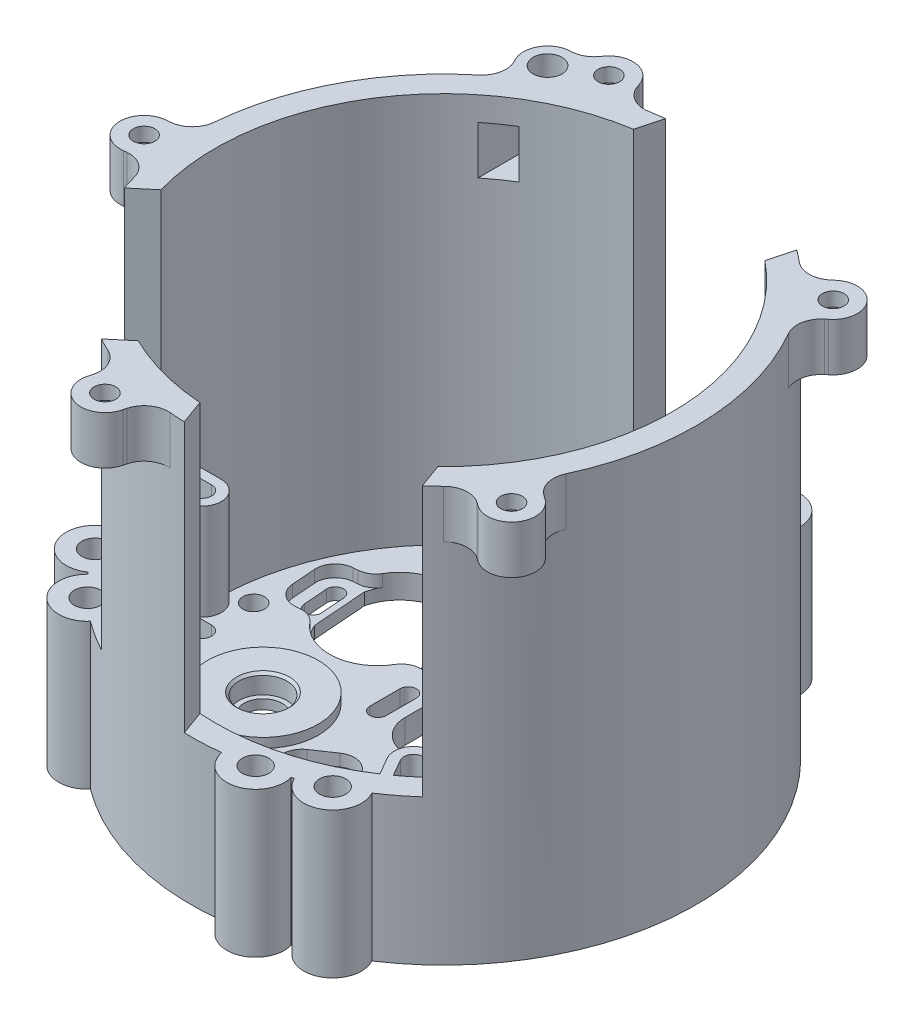
from build123d import *
from build123d.topology import SkipClean

# Parameters (mm, degrees)
CIRPATTERN1_COUNT              = 3
BOSS_EXTRUDE3_START            = -4
SKETCH3_R                      = 47.5
SKETCH3_R_2                    = 11.5
SKETCH3_R_3                    = 10
BOSS_EXTRUDE3_DEPTH            = 5
R_P_TITION_CIRCULAIRE1_COUNT   = 3
ENL_V_MAT_EXTRU_2_DEPTH        = 68.549315319
ENL_V_MAT_EXTRU_2_DEPTH_BACK   = 68.549315319
CHANFREIN1_SIZE                = 0.5
CONG_1_R                       = 1
CHANFREIN3_SIZE                = 1.5
ENL_V_START                    = -2.5
ENL_V_MAT_EXTRU_3_DEPTH        = 2.5
ENL_V_MAT_EXTRU_4_REACH        = 69.361
BOSS_EXTRU_1_START             = -5
BOSS_EXTRU_1_DEPTH             = 2.5
CONG_2_R                       = 4
ESQUISSE9_R                    = 5
ESQUISSE9_R_2                  = 2
BOSS_EXTRU_2_DEPTH             = 4
M2_CLEARANCE_HOLE1_D           = 2.4
M4_CLEARANCE_HOLE1_D           = 4.5
ENL_V_MAT_EXTRU_5_REACH        = 69.361
ESQUISSE18_R                   = 52.5
ESQUISSE18_R_2                 = 47.5
BOSS_EXTRU_3_DEPTH             = 30.25
BOSS_EXTRU_4_DEPTH             = 56
BOSS_EXTRU_5_START             = -30.25
BOSS_EXTRU_5_DEPTH             = 30.25
M5_CLEARANCE_HOLE1_D           = 5.5
F_7_1_7_1_DIAMETER_HOLE1_D     = 7.1
F_7_1_7_1_DIAMETER_HOLE1_DEPTH = 11.1
F_7_1_7_1_DIAMETER_HOLE1_TIP   = 2.133055198
CHANFREIN4_SIZE                = 0.5
BOSS_EXTRU_7_START             = -10
ESQUISSE27_R                   = 2.7
BOSS_EXTRU_7_DEPTH             = 10
BOSS_EXTRU_8_START             = -2.9
ESQUISSE27_2_R                 = 2.7
BOSS_EXTRU_8_DEPTH             = 2.9
M4_CLEARANCE_HOLE2_D           = 4.5
CONG_4_R                       = 5
CHANFREIN5_SIZE                = 0.5
SKETCH4_R                      = 5
SKETCH4_R_2                    = 3
BOSS_EXTRUDE8_DEPTH            = 86.25
FILLET1_R                      = 5
FILLET2_R                      = 5
CUT_EXTRUDE1_REACH             = 121.621
CUT_EXTRUDE1_END_RADIUS        = 3
SKETCH5_W                      = 5
SKETCH5_H                      = 10
CUT_EXTRUDE2_START             = 2.25
CUT_EXTRUDE2_DEPTH             = 10
CUT_EXTRUDE2_START_2           = 22.25
CUT_EXTRUDE2_2_DEPTH           = 10
CUT_EXTRUDE2_START_3           = 42.25
CUT_EXTRUDE2_3_DEPTH           = 10
CUT_EXTRUDE2_START_4           = 62.25
CUT_EXTRUDE2_4_DEPTH           = 10
FILLET3_R                      = 5
BOSS_EXTRUDE9_DEPTH            = 20
CUT_EXTRUDE4_DEPTH             = 104.344704146
CUT_EXTRUDE4_DEPTH_BACK        = 104.344704146


# Read off the part's stored shape, not the designer's step: Cut-Extrude2
with BuildPart() as part:
    # Sketch2 → Revolve1 (revolve)
    with BuildSketch(Plane(origin=(0, 0, 0), x_dir=(0, 0, -1), z_dir=(1, 0, 0))):
        Polygon((21, 0), (21, -3), (23.5, -3), (23.5, -1), (22.5, -1), (22.5, 3), (16, 3), (16, -4), (17.5, -4), (17.5, 0), align=None)
    revolve(axis=Axis((0, 24.43625, -27.5), (0, -1, 0)))


with BuildPart() as cirpattern1_1:
    # CirPattern1: pattern copy
    add(part.part.rotate(Axis((0, 0, 0), (0, 1, 0)), 1 * 360 / CIRPATTERN1_COUNT))


with BuildPart() as cirpattern1_2:
    # CirPattern1: pattern copy
    add(part.part.rotate(Axis((0, 0, 0), (0, 1, 0)), 2 * 360 / CIRPATTERN1_COUNT))


with BuildPart() as part_1:
    add(part.part)

    add(cirpattern1_1.part)  # Boss-Extrude3 merges CirPattern1_1

    add(cirpattern1_2.part)  # Boss-Extrude3 merges CirPattern1_2
    # Sketch3 → Boss-Extrude3 (add)
    with BuildSketch(Plane(origin=(0, 0, 0), x_dir=(1, 0, 0), z_dir=(0, 1, 0)).offset(BOSS_EXTRUDE3_START)):
        Circle(SKETCH3_R)
        with Locations(Location((-23.815698604, -13.75, 0), (0, 0, 30))):
            Circle(SKETCH3_R_2, mode=Mode.SUBTRACT)
        with Locations((0, -30)):
            Circle(SKETCH3_R_3, mode=Mode.SUBTRACT)
        with Locations(Location((23.815698604, -13.75, 0), (0, 0, 150))):
            Circle(SKETCH3_R_2, mode=Mode.SUBTRACT)
        with Locations((-25.980762114, 15)):
            Circle(SKETCH3_R_3, mode=Mode.SUBTRACT)
        with BuildLine():
            ThreePointArc((6.5, -1.5), (0, -8), (-6.5, -1.5))
            Line((-6.5, -1.5), (-6.5, 5.5))
            ThreePointArc((-6.5, 5.5), (0, 12), (6.5, 5.5))
            Line((6.5, 5.5), (6.5, -1.5))
        make_face(mode=Mode.SUBTRACT)
        with Locations((25.980762114, 15)):
            Circle(SKETCH3_R_3, mode=Mode.SUBTRACT)
        with Locations(Location((0, 27.5, 0), (0, 0, 270))):
            Circle(SKETCH3_R_2, mode=Mode.SUBTRACT)
    extrude(amount=BOSS_EXTRUDE3_DEPTH)

    # Esquisse4 → Révolution1 (revolve)
    with BuildSketch(Plane(origin=(0, 0, 0), x_dir=(0, 0, -1), z_dir=(1, 0, 0))):
        Polygon((-38, -4.6), (-38, -0.6), (-38.4, -0.6), (-38.4, 0.5), (-38, 0.5), (-38, 1.5), (-40, 1.5), (-40, -6.1), (-36.5, -6.1), (-36.5, -4.6), align=None)
    r_volution1 = revolve(axis=Axis((0, 11.147589679, 30), (0, -1, 0)))

    # Répétition circulaire1: Révolution1 ×3 about axis
    r_p_tition_circulaire1_axis = Axis((0, 0, 0), (0, 1, 0))
    for i in range(1, R_P_TITION_CIRCULAIRE1_COUNT):
        add(r_volution1.rotate(r_p_tition_circulaire1_axis, i * 360 / R_P_TITION_CIRCULAIRE1_COUNT))

    # Esquisse6 → Enlèv. mat.-Extru.2 (cut, two sides: drawn at the far end of the back side and taken through both)
    with BuildSketch(Plane(origin=(0, 1, 0), x_dir=(1, 0, 0), z_dir=(0, 1, 0)).offset(-ENL_V_MAT_EXTRU_2_DEPTH_BACK)):
        with BuildLine():
            Line((27.61293062, 25.311936092), (32.118566189, 23.144161168))
            ThreePointArc((32.118566189, 23.144161168), (36.794287479, 9.797340183), (23.447466493, 5.121618893))
            Line((23.447466493, 5.121618893), (18.941830925, 7.289393816))
            ThreePointArc((18.941830925, 7.289393816), (14.266109634, 20.636214802), (27.61293062, 25.311936092))
        make_face()
        with BuildLine():
            Line((8.114314365, -36.569467436), (3.984148427, -39.387574837))
            ThreePointArc((3.984148427, -39.387574837), (-9.912398252, -36.763457762), (-7.288281177, -22.866911084))
            Line((-7.288281177, -22.866911084), (-3.158115239, -20.048803683))
            ThreePointArc((-3.158115239, -20.048803683), (10.738431439, -22.672920758), (8.114314365, -36.569467436))
        make_face()
        with BuildLine():
            Line((-35.727244985, 11.257531344), (-36.102714615, 16.243413668))
            ThreePointArc((-36.102714615, 16.243413668), (-26.881889227, 26.966117579), (-16.159185316, 17.745292191))
            Line((-16.159185316, 17.745292191), (-15.783715686, 12.759409867))
            ThreePointArc((-15.783715686, 12.759409867), (-25.004541074, 2.036705956), (-35.727244985, 11.257531344))
        make_face()
    extrude(amount=ENL_V_MAT_EXTRU_2_DEPTH + ENL_V_MAT_EXTRU_2_DEPTH_BACK, mode=Mode.SUBTRACT)

    # Chanfrein1
    chanfrein1_edges = [part_1.edges().sort_by_distance(p)[0] for p in [
        (0, 3, -32.5),
        (28.145825623, 3, 16.25),
        (-28.145825623, 3, 16.25),
    ]]
    chamfer(chanfrein1_edges, length=CHANFREIN1_SIZE)

    # Congé1
    cong_1_edges = [part_1.edges().sort_by_distance(p)[0] for p in [
        (0, 0, -37.5),
        (29.444863729, 0, 17),
        (32.475952642, 0, 18.75),
        (-29.444863729, 0, 17),
        (-32.475952642, 0, 18.75),
        (0, 0, -34),
    ]]
    fillet(cong_1_edges, radius=CONG_1_R)

    # Chanfrein3
    chanfrein3_edges = [part_1.edges().sort_by_distance(p)[0] for p in [
        (0, -4, -37.5),
        (32.475952642, -4, 18.75),
        (-32.475952642, -4, 18.75),
    ]]
    chamfer(chanfrein3_edges, length=CHANFREIN3_SIZE)

    # Esquisse7 → Enlèv. mat.-Extru.3 (cut)
    with BuildSketch(Plane(origin=(0, 1, 0), x_dir=(1, 0, 0), z_dir=(0, 1, 0)).offset(ENL_V_START)):
        with BuildLine():
            ThreePointArc((3.984148427, -39.387574837), (2.177594413, -40.364867019), (0.209477067, -40.952448099))
            Line((0.209477067, -40.952448099), (2.089069377, -43.707143727))
            ThreePointArc((2.089069377, -43.707143727), (4.650989736, -45.383194762), (7.647688048, -44.756790556))
            Line((7.647688048, -44.756790556), (11.777853986, -41.938683155))
            ThreePointArc((11.777853986, -41.938683155), (13.453905022, -39.376762796), (12.827500816, -36.380064484))
            Line((12.827500816, -36.380064484), (10.947908506, -33.625368856))
            ThreePointArc((10.947908506, -33.625368856), (9.683091276, -35.243693542), (8.114314365, -36.569467436))
            Line((8.114314365, -36.569467436), (3.984148427, -39.387574837))
        make_face()
        with BuildLine():
            Line((-6.82165486, -14.679587964), (-10.951820798, -17.497695364))
            ThreePointArc((-10.951820798, -17.497695364), (-12.627871834, -20.059615724), (-12.001467628, -23.056314036))
            Line((-12.001467628, -23.056314036), (-10.121875318, -25.811009663))
            ThreePointArc((-10.121875318, -25.811009663), (-8.857058088, -24.192684978), (-7.288281177, -22.866911084))
            Line((-7.288281177, -22.866911084), (-3.158115239, -20.048803683))
            ThreePointArc((-3.158115239, -20.048803683), (-1.351561225, -19.071511501), (0.616556121, -18.483930421))
            Line((0.616556121, -18.483930421), (-1.263036189, -15.729234793))
            ThreePointArc((-1.263036189, -15.729234793), (-3.824956548, -14.053183758), (-6.82165486, -14.679587964))
        make_face()
        with BuildLine():
            ThreePointArc((-38.896031482, 20.044384713), (-41.628494437, 18.663722117), (-42.584361638, 15.755303148))
            Line((-42.584361638, 15.755303148), (-42.208892007, 10.769420824))
            ThreePointArc((-42.208892007, 10.769420824), (-40.828229411, 8.036957869), (-37.919810442, 7.081090668))
            Line((-37.919810442, 7.081090668), (-34.594377894, 7.331517544))
            ThreePointArc((-34.594377894, 7.331517544), (-35.363479569, 9.236043739), (-35.727244985, 11.257531344))
            Line((-35.727244985, 11.257531344), (-36.102714615, 16.243413668))
            ThreePointArc((-36.102714615, 16.243413668), (-36.045797465, 18.296581429), (-35.570598934, 20.294811588))
            Line((-35.570598934, 20.294811588), (-38.896031482, 20.044384713))
        make_face()
        with BuildLine():
            Line((-16.159185316, 17.745292191), (-15.783715686, 12.759409867))
            ThreePointArc((-15.783715686, 12.759409867), (-15.840632836, 10.706242106), (-16.315831367, 8.708011947))
            Line((-16.315831367, 8.708011947), (-12.990398819, 8.958438822))
            ThreePointArc((-12.990398819, 8.958438822), (-10.257935864, 10.339101418), (-9.302068663, 13.247520387))
            Line((-9.302068663, 13.247520387), (-9.677538294, 18.233402711))
            ThreePointArc((-9.677538294, 18.233402711), (-11.05820089, 20.965865666), (-13.966619859, 21.921732867))
            Line((-13.966619859, 21.921732867), (-17.292052407, 21.671305991))
            ThreePointArc((-17.292052407, 21.671305991), (-16.522950732, 19.766779796), (-16.159185316, 17.745292191))
        make_face()
        with BuildLine():
            ThreePointArc((36.806962106, 23.662759014), (36.977504701, 26.719472645), (34.93667359, 29.001487408))
            Line((34.93667359, 29.001487408), (30.431038021, 31.169262332))
            ThreePointArc((30.431038021, 31.169262332), (27.374324389, 31.339804927), (25.092309627, 29.298973816))
            Line((25.092309627, 29.298973816), (23.646469388, 26.293851313))
            ThreePointArc((23.646469388, 26.293851313), (25.680388293, 26.007649803), (27.61293062, 25.311936092))
            Line((27.61293062, 25.311936092), (32.118566189, 23.144161168))
            ThreePointArc((32.118566189, 23.144161168), (33.868203052, 22.06828559), (35.361121867, 20.657636511))
            Line((35.361121867, 20.657636511), (36.806962106, 23.662759014))
        make_face()
        with BuildLine():
            Line((23.447466493, 5.121618893), (18.941830925, 7.289393816))
            ThreePointArc((18.941830925, 7.289393816), (17.192194061, 8.365269395), (15.699275246, 9.775918474))
            Line((15.699275246, 9.775918474), (14.253435008, 6.770795971))
            ThreePointArc((14.253435008, 6.770795971), (14.082892412, 3.71408234), (16.123723524, 1.432067577))
            Line((16.123723524, 1.432067577), (20.629359093, -0.735707347))
            ThreePointArc((20.629359093, -0.735707347), (23.686072724, -0.906249942), (25.968087487, 1.134581169))
            Line((25.968087487, 1.134581169), (27.413927725, 4.139703672))
            ThreePointArc((27.413927725, 4.139703672), (25.380008821, 4.425905182), (23.447466493, 5.121618893))
        make_face()
    extrude(amount=ENL_V_MAT_EXTRU_3_DEPTH, mode=Mode.SUBTRACT)

    # Esquisse8 → Enlèv. mat.-Extru.4 (cut, up to next)
    with BuildSketch(Plane(origin=(0, 1, 0), x_dir=(1, 0, 0), z_dir=(0, 1, 0)), mode=Mode.PRIVATE) as enl_v_mat_extru_4_sk1:
        with BuildLine():
            Line((-9.655491394, -19.397571696), (-5.525325456, -16.579464295))
            ThreePointArc((-5.525325456, -16.579464295), (-3.162912521, -17.025564198), (-3.609012423, -19.387977133))
            Line((-3.609012423, -19.387977133), (-7.739178361, -22.206084534))
            ThreePointArc((-7.739178361, -22.206084534), (-10.101591297, -21.759984631), (-9.655491394, -19.397571696))
        make_face()
    enl_v_mat_extru_4_tool1 = extrude(enl_v_mat_extru_4_sk1.sketch, amount=-ENL_V_MAT_EXTRU_4_REACH, mode=Mode.PRIVATE) & part_1.part
    # Esquisse8 → Enlèv. mat.-Extru.4 (cut, up to next)
    with BuildSketch(Plane(origin=(0, 1, 0), x_dir=(1, 0, 0), z_dir=(0, 1, 0)), mode=Mode.PRIVATE) as enl_v_mat_extru_4_sk2:
        with BuildLine():
            Line((4.435045611, -40.048401387), (8.565211549, -37.230293986))
            ThreePointArc((8.565211549, -37.230293986), (10.927624484, -37.676393888), (10.481524582, -40.038806824))
            Line((10.481524582, -40.038806824), (6.351358643, -42.856914225))
            ThreePointArc((6.351358643, -42.856914225), (3.988945708, -42.410814322), (4.435045611, -40.048401387))
        make_face()
    enl_v_mat_extru_4_tool2 = extrude(enl_v_mat_extru_4_sk2.sketch, amount=-ENL_V_MAT_EXTRU_4_REACH, mode=Mode.PRIVATE) & part_1.part
    # Esquisse8 → Enlèv. mat.-Extru.4 (cut, up to next)
    with BuildSketch(Plane(origin=(0, 1, 0), x_dir=(1, 0, 0), z_dir=(0, 1, 0)), mode=Mode.PRIVATE) as enl_v_mat_extru_4_sk3:
        with BuildLine():
            Line((21.626535557, 1.336885015), (17.120899989, 3.504659939))
            ThreePointArc((17.120899989, 3.504659939), (16.326027369, 5.773619506), (18.594986937, 6.568492125))
            Line((18.594986937, 6.568492125), (23.100622506, 4.400717202))
            ThreePointArc((23.100622506, 4.400717202), (23.895495125, 2.131757634), (21.626535557, 1.336885015))
        make_face()
    enl_v_mat_extru_4_tool3 = extrude(enl_v_mat_extru_4_sk3.sketch, amount=-ENL_V_MAT_EXTRU_4_REACH, mode=Mode.PRIVATE) & part_1.part
    # Esquisse8 → Enlèv. mat.-Extru.4 (cut, up to next)
    with BuildSketch(Plane(origin=(0, 1, 0), x_dir=(1, 0, 0), z_dir=(0, 1, 0)), mode=Mode.PRIVATE) as enl_v_mat_extru_4_sk4:
        with BuildLine():
            Line((32.465410177, 23.865062859), (27.959774608, 26.032837783))
            ThreePointArc((27.959774608, 26.032837783), (27.164901988, 28.301797351), (29.433861556, 29.09666997))
            Line((29.433861556, 29.09666997), (33.939497125, 26.928895046))
            ThreePointArc((33.939497125, 26.928895046), (34.734369744, 24.659935479), (32.465410177, 23.865062859))
        make_face()
    enl_v_mat_extru_4_tool4 = extrude(enl_v_mat_extru_4_sk4.sketch, amount=-ENL_V_MAT_EXTRU_4_REACH, mode=Mode.PRIVATE) & part_1.part
    # Esquisse8 → Enlèv. mat.-Extru.4 (cut, up to next)
    with BuildSketch(Plane(origin=(0, 1, 0), x_dir=(1, 0, 0), z_dir=(0, 1, 0)), mode=Mode.PRIVATE) as enl_v_mat_extru_4_sk5:
        with BuildLine():
            Line((-14.985974514, 12.819485008), (-15.361444144, 17.805367332))
            ThreePointArc((-15.361444144, 17.805367332), (-13.793903828, 19.628226997), (-11.971044164, 18.060686681))
            Line((-11.971044164, 18.060686681), (-11.595574533, 13.074804356))
            ThreePointArc((-11.595574533, 13.074804356), (-13.163114849, 11.251944692), (-14.985974514, 12.819485008))
        make_face()
    enl_v_mat_extru_4_tool5 = extrude(enl_v_mat_extru_4_sk5.sketch, amount=-ENL_V_MAT_EXTRU_4_REACH, mode=Mode.PRIVATE) & part_1.part
    # Esquisse8 → Enlèv. mat.-Extru.4 (cut, up to next)
    with BuildSketch(Plane(origin=(0, 1, 0), x_dir=(1, 0, 0), z_dir=(0, 1, 0)), mode=Mode.PRIVATE) as enl_v_mat_extru_4_sk6:
        with BuildLine():
            Line((-39.915386137, 10.942136854), (-40.290855768, 15.928019179))
            ThreePointArc((-40.290855768, 15.928019179), (-38.723315452, 17.750878843), (-36.900455787, 16.183338528))
            Line((-36.900455787, 16.183338528), (-36.524986157, 11.197456203))
            ThreePointArc((-36.524986157, 11.197456203), (-38.092526473, 9.374596538), (-39.915386137, 10.942136854))
        make_face()
    enl_v_mat_extru_4_tool6 = extrude(enl_v_mat_extru_4_sk6.sketch, amount=-ENL_V_MAT_EXTRU_4_REACH, mode=Mode.PRIVATE) & part_1.part
    add(enl_v_mat_extru_4_tool1.solids().sort_by_distance((-6.632252, 1, 19.392774))[0], mode=Mode.SUBTRACT)
    add(enl_v_mat_extru_4_tool2.solids().sort_by_distance((7.458285, 1, 40.043604))[0], mode=Mode.SUBTRACT)
    add(enl_v_mat_extru_4_tool3.solids().sort_by_distance((20.110761, 1, -3.952689))[0], mode=Mode.SUBTRACT)
    add(enl_v_mat_extru_4_tool4.solids().sort_by_distance((30.949636, 1, -26.480866))[0], mode=Mode.SUBTRACT)
    add(enl_v_mat_extru_4_tool5.solids().sort_by_distance((-13.478509, 1, -15.440086))[0], mode=Mode.SUBTRACT)
    add(enl_v_mat_extru_4_tool6.solids().sort_by_distance((-38.407921, 1, -13.562738))[0], mode=Mode.SUBTRACT)

    # Esquisse8<2> → Boss.-Extru.1 (add)
    with BuildSketch(Plane(origin=(0, 1, 0), x_dir=(1, 0, 0), z_dir=(0, 1, 0)).offset(BOSS_EXTRU_1_START)):
        with BuildLine():
            Line((8.114314365, -36.569467436), (3.984148427, -39.387574837))
            ThreePointArc((3.984148427, -39.387574837), (2.607176673, -40.174830963), (1.123049885, -40.734465751))
            Line((1.123049885, -40.734465751), (10.411791426, -34.396543334))
            ThreePointArc((10.411791426, -34.396543334), (9.349488907, -35.574395946), (8.114314365, -36.569467436))
        make_face()
        with BuildLine():
            Line((-7.288281177, -22.866911084), (-3.158115239, -20.048803683))
            ThreePointArc((-3.158115239, -20.048803683), (-1.781143485, -19.261547557), (-0.297016697, -18.701912769))
            Line((-0.297016697, -18.701912769), (-9.585758239, -25.039835186))
            ThreePointArc((-9.585758239, -25.039835186), (-8.523455719, -23.861982574), (-7.288281177, -22.866911084))
        make_face()
        with BuildLine():
            Line((-35.727244985, 11.257531344), (-36.102714615, 16.243413668))
            ThreePointArc((-36.102714615, 16.243413668), (-36.096012543, 17.829534251), (-35.838607092, 19.394643145))
            Line((-35.838607092, 19.394643145), (-34.994176043, 8.181395793))
            ThreePointArc((-34.994176043, 8.181395793), (-35.483075067, 9.690303067), (-35.727244985, 11.257531344))
        make_face()
        with BuildLine():
            Line((27.61293062, 25.311936092), (32.118566189, 23.144161168))
            ThreePointArc((32.118566189, 23.144161168), (33.48883587, 22.345296712), (34.715557207, 21.339822605))
            Line((34.715557207, 21.339822605), (24.582384617, 26.215147541))
            ThreePointArc((24.582384617, 26.215147541), (26.13358616, 25.884092879), (27.61293062, 25.311936092))
        make_face()
        with BuildLine():
            Line((-16.892254258, 20.821427742), (-16.047823209, 9.60818039))
            ThreePointArc((-16.047823209, 9.60818039), (-15.790417758, 11.173289285), (-15.783715686, 12.759409867))
            Line((-15.783715686, 12.759409867), (-16.159185316, 17.745292191))
            ThreePointArc((-16.159185316, 17.745292191), (-16.403355234, 19.312520468), (-16.892254258, 20.821427742))
        make_face()
        with BuildLine():
            Line((26.478012497, 4.218407444), (16.344839906, 9.093732379))
            ThreePointArc((16.344839906, 9.093732379), (17.571561243, 8.088258273), (18.941830925, 7.289393816))
            Line((18.941830925, 7.289393816), (23.447466493, 5.121618893))
            ThreePointArc((23.447466493, 5.121618893), (24.926810953, 4.549462106), (26.478012497, 4.218407444))
        make_face()
    extrude(amount=BOSS_EXTRU_1_DEPTH)

    # Congé2
    cong_2_edges = [part_1.edges().sort_by_distance(p)[0] for p in [
        (-35.570598934, -0.25, -20.294811588),
        (-34.594377894, -0.25, -7.331517544),
        (0.209477067, -0.25, 40.952448099),
        (10.947908506, -0.25, 33.625368856),
        (15.699275246, -0.25, -9.775918474),
        (27.413927725, -0.25, -4.139703672),
        (35.361121867, -0.25, -20.657636511),
        (23.646469388, -0.25, -26.293851313),
        (-16.315831367, -0.25, -8.708011947),
        (-17.292052407, -0.25, -21.671305991),
        (0.616556121, -0.25, 18.483930421),
        (-10.121875318, -0.25, 25.811009663),
    ]]
    fillet(cong_2_edges, radius=CONG_2_R)

    # Esquisse9 → Boss.-Extru.2 (add)
    # profile 1 of 2: a face of its own
    with BuildSketch(Plane(origin=(0, 1, 0), x_dir=(1, 0, 0), z_dir=(0, 1, 0))):
        with Locations((-17.433003297, 37.385196215)):
            Circle(ESQUISSE9_R)
        with Locations(Location((-17.433003297, 37.385196215, 0), (0, 0, 180))):
            Circle(ESQUISSE9_R_2, mode=Mode.SUBTRACT)
    # profile 2 of 2: a face of its own
    with BuildSketch(Plane(origin=(0, 1, 0), x_dir=(1, 0, 0), z_dir=(0, 1, 0))):
        with Locations((41.25, 0)):
            Circle(ESQUISSE9_R)
        with Locations(Location((41.25, 0, 0), (0, 0, 180))):
            Circle(ESQUISSE9_R_2, mode=Mode.SUBTRACT)
    extrude(amount=BOSS_EXTRU_2_DEPTH)

    # M2 Clearance Hole1 (through all)
    with Locations(Plane(origin=(0, 1, 0), x_dir=(1, 0, 0), z_dir=(0, 1, 0))):
        with Locations((-17.433003297, 37.385196215), (41.25, 0)):
            Hole(M2_CLEARANCE_HOLE1_D / 2)

    # M4 Clearance Hole1 (through all)
    with Locations(Plane(origin=(0, 1, 0), x_dir=(1, 0, 0), z_dir=(0, 1, 0))):
        with Locations((-26.176741447, 34.114193633), (24.355468188, 35.437426111), (18.511977163, -38.811167227), (-16.455387592, -39.726819898), (-42.867445351, 3.373741116)):
            Hole(M4_CLEARANCE_HOLE1_D / 2)

    # Esquisse17 → Enlèv. mat.-Extru.5 (cut, up to next)
    with BuildSketch(Plane(origin=(0, 1, 0), x_dir=(1, 0, 0), z_dir=(0, 1, 0)), mode=Mode.PRIVATE) as enl_v_mat_extru_5_sk1:
        with BuildLine():
            Line((-12.2, -3.132912152), (-12.2, 3.132912152))
            ThreePointArc((-12.2, 3.132912152), (-10.5, 4.832912152), (-8.8, 3.132912152))
            Line((-8.8, 3.132912152), (-8.8, -3.132912152))
            ThreePointArc((-8.8, -3.132912152), (-10.5, -4.832912152), (-12.2, -3.132912152))
        make_face()
    enl_v_mat_extru_5_tool1 = extrude(enl_v_mat_extru_5_sk1.sketch, amount=-ENL_V_MAT_EXTRU_5_REACH, mode=Mode.PRIVATE) & part_1.part
    # Esquisse17 → Enlèv. mat.-Extru.5 (cut, up to next)
    with BuildSketch(Plane(origin=(0, 1, 0), x_dir=(1, 0, 0), z_dir=(0, 1, 0)), mode=Mode.PRIVATE) as enl_v_mat_extru_5_sk2:
        with BuildLine():
            Line((8.8, -3.132912152), (8.8, 3.132912152))
            ThreePointArc((8.8, 3.132912152), (10.5, 4.832912152), (12.2, 3.132912152))
            Line((12.2, 3.132912152), (12.2, -3.132912152))
            ThreePointArc((12.2, -3.132912152), (10.5, -4.832912152), (8.8, -3.132912152))
        make_face()
    enl_v_mat_extru_5_tool2 = extrude(enl_v_mat_extru_5_sk2.sketch, amount=-ENL_V_MAT_EXTRU_5_REACH, mode=Mode.PRIVATE) & part_1.part
    add(enl_v_mat_extru_5_tool1.solids().sort_by_distance((-10.5, 1, 0))[0], mode=Mode.SUBTRACT)
    add(enl_v_mat_extru_5_tool2.solids().sort_by_distance((10.5, 1, 0))[0], mode=Mode.SUBTRACT)

    # Esquisse18 → Boss.-Extru.3 (add)
    with BuildSketch(Plane.XZ.offset(4)):
        with Locations(Location((0, 0, 0), (0, 0, 270))):
            Circle(ESQUISSE18_R)
        with Locations(Location((0, 0, 0), (0, 0, 270))):
            Circle(ESQUISSE18_R_2, mode=Mode.SUBTRACT)
    extrude(amount=-BOSS_EXTRU_3_DEPTH)

    # Esquisse19 → Boss.-Extru.4 (add)
    with SkipClean():  # the faces are left unmerged after this step: merging them gives an invalid solid
        with BuildSketch(Plane(origin=(0, 26.25, 0), x_dir=(1, 0, 0), z_dir=(0, 1, 0))):
            with BuildLine():
                ThreePointArc((-6.005848288, 52.155342836), (-44.278050905, 28.208229438), (-49.806974512, -16.598653259))
                Line((-49.806974512, -16.598653259), (-45.653894731, -13.113805546))
                ThreePointArc((-45.653894731, -13.113805546), (-40.061093676, 25.521731396), (-7.409025549, 46.918614008))
                Line((-7.409025549, 46.918614008), (-6.005848288, 52.155342836))
            make_face()
            with BuildLine():
                Line((32.980529845, -34.183836109), (34.834778583, -39.278342646))
                ThreePointArc((34.834778583, -39.278342646), (47.880454653, -21.533974603), (52.5, 0))
                ThreePointArc((52.5, 0), (46.89558429, 23.601995129), (31.278888607, 42.164927695))
                Line((31.278888607, 42.164927695), (29.875711346, 36.928198867))
                ThreePointArc((29.875711346, 36.928198867), (42.868090049, 20.459150899), (47.5, 0))
                ThreePointArc((47.5, 0), (43.719704755, -18.569798496), (32.980529845, -34.183836109))
            make_face()
            with BuildLine():
                ThreePointArc((-24.995372778, -46.167968763), (-13.587999868, -50.71110588), (-1.437356579, -52.480320179))
                Line((-1.437356579, -52.480320179), (-3.291605317, -47.385813641))
                ThreePointArc((-3.291605317, -47.385813641), (-12.293904642, -45.881476749), (-20.842292997, -42.683121051))
                Line((-20.842292997, -42.683121051), (-24.995372778, -46.167968763))
            make_face()
        extrude(amount=BOSS_EXTRU_4_DEPTH)

    # Esquisse20 → Boss.-Extru.5 (add)
    with BuildSketch(Plane(origin=(0, 26.25, 0), x_dir=(1, 0, 0), z_dir=(0, 1, 0)).offset(BOSS_EXTRU_5_START)):
        with BuildLine():
            ThreePointArc((10.01067008, 46.433139939), (8.271767921, 57.785217881), (3.417930762, 47.376869349))
            ThreePointArc((3.417930762, 47.376869349), (6.73086075, 47.020692398), (10.01067008, 46.433139939))
        make_face()
        with BuildLine():
            ThreePointArc((20.728419807, 42.738537789), (21.729047787, 54.179350608), (14.547075371, 45.217613804))
            ThreePointArc((14.547075371, 45.217613804), (17.6812498, 44.086544495), (20.728419807, 42.738537789))
        make_face()
        with BuildLine():
            ThreePointArc((18.432694074, -43.777685973), (26.368403744, -52.079370523), (24.374450916, -40.769303925))
            ThreePointArc((24.374450916, -40.769303925), (21.456362837, -42.377759424), (18.432694074, -43.777685973))
        make_face()
        with BuildLine():
            ThreePointArc((7.53409074, -46.898693763), (13.276604931, -56.844395604), (14.019491257, -45.383960436))
            ThreePointArc((14.019491257, -45.383960436), (10.803371163, -46.255131299), (7.53409074, -46.898693763))
        make_face()
        with BuildLine():
            ThreePointArc((-34.833215795, -32.293917034), (-39.920074948, -42.590388191), (-29.974060857, -36.848414833))
            ThreePointArc((-29.974060857, -36.848414833), (-32.483559524, -34.656433179), (-34.833215795, -32.293917034))
        make_face()
        with BuildLine():
            ThreePointArc((-41.493545659, -23.120027436), (-48.875392761, -31.917856014), (-37.852024315, -28.696241135))
            ThreePointArc((-37.852024315, -28.696241135), (-39.770635002, -25.972034798), (-41.493545659, -23.120027436))
        make_face()
    extrude(amount=BOSS_EXTRU_5_DEPTH)

    # M5 Clearance Hole1 (through all)
    with Locations(Plane(origin=(0, 26.25, 0), x_dir=(1, 0, 0), z_dir=(0, 1, 0))):
        with Locations((7.421553931, 51.845761999), (19.49562676, 48.610523935), (-43.851733603, -28.637177934), (-35.816888482, -38.212733473), (11.911968573, -51.001642177), (23.658126333, -46.726390385)):
            Hole(M5_CLEARANCE_HOLE1_D / 2)

    # Ø7.1 (7.1) Diameter Hole1
    with Locations(Plane(origin=(0, -4, 0), x_dir=(-1, 0, 0), z_dir=(0, -1, 0))):
        with Locations((-7.421553931, 51.845761999), (-19.49562676, 48.610523935), (43.851733603, -28.637177934), (35.816888482, -38.212733473), (-11.911968573, -51.001642177), (-23.658126333, -46.726390385)):
            Hole(F_7_1_7_1_DIAMETER_HOLE1_D / 2, depth=F_7_1_7_1_DIAMETER_HOLE1_DEPTH)
            with Locations((0, 0, -(F_7_1_7_1_DIAMETER_HOLE1_DEPTH + F_7_1_7_1_DIAMETER_HOLE1_TIP / 2))):  # 118° drill point
                Cone(0, F_7_1_7_1_DIAMETER_HOLE1_D / 2, F_7_1_7_1_DIAMETER_HOLE1_TIP, mode=Mode.SUBTRACT)

    # Chanfrein4
    chanfrein4_edges = [part_1.edges().sort_by_distance(p)[0] for p in [
        (20.108126333, -4, 46.726390385),
        (8.361968573, -4, 51.001642177),
        (-39.366888482, -4, 38.212733473),
        (-47.401733603, -4, 28.637177934),
        (15.94562676, -4, -48.610523935),
        (3.871553931, -4, -51.845761999),
    ]]
    chamfer(chanfrein4_edges, length=CHANFREIN4_SIZE)

    # Esquisse27 → Boss.-Extru.7 (add)
    # profile 1 of 5: a face of its own
    with BuildSketch(Plane(origin=(0, 82.25, 0), x_dir=(1, 0, 0), z_dir=(0, 1, 0)).offset(BOSS_EXTRU_7_START)):
        with BuildLine():
            Line((-10.000767978, -56.623622631), (-8.701290829, -51.773907887))
            ThreePointArc((-8.701290829, -51.773907887), (-13.587999868, -50.71110588), (-18.35141504, -49.188164898))
            Line((-18.35141504, -49.188164898), (-19.650892189, -54.037879642))
            ThreePointArc((-19.650892189, -54.037879642), (-16.176190319, -60.370364143), (-10.000767978, -56.623622631))
        make_face()
        with Locations(Location((-14.882095093, -55.540735012, 0), (0, 0, 270))):
            Circle(ESQUISSE27_R, mode=Mode.SUBTRACT)
    # profile 2 of 5: a face of its own
    with BuildSketch(Plane(origin=(0, 82.25, 0), x_dir=(1, 0, 0), z_dir=(0, 1, 0)).offset(BOSS_EXTRU_7_START)):
        with BuildLine():
            Line((-56.629264446, -9.968771656), (-51.627575927, -9.531180613))
            ThreePointArc((-51.627575927, -9.531180613), (-52.30022165, -4.575676494), (-52.498309187, 0.421346085))
            Line((-52.498309187, 0.421346085), (-57.499997705, -0.016244958))
            ThreePointArc((-57.499997705, -0.016244958), (-62.262168631, -5.447233922), (-56.629264446, -9.968771656))
        make_face()
        with Locations(Location((-57.28119514, -5.011455208, 0), (0, 0, 270))):
            Circle(ESQUISSE27_R, mode=Mode.SUBTRACT)
    # profile 3 of 5: a face of its own
    with BuildSketch(Plane(origin=(0, 82.25, 0), x_dir=(1, 0, 0), z_dir=(0, 1, 0)).offset(BOSS_EXTRU_7_START)):
        with BuildLine():
            Line((-24.285826148, 52.119561091), (-22.568613411, 47.401557872))
            ThreePointArc((-22.568613411, 47.401557872), (-17.956057525, 49.333862591), (-13.180573187, 50.818525072))
            Line((-13.180573187, 50.818525072), (-14.897785924, 55.53652829))
            ThreePointArc((-14.897785924, 55.53652829), (-21.376258958, 58.730788799), (-24.285826148, 52.119561091))
        make_face()
        with Locations(Location((-19.666158241, 54.032325695, 0), (0, 0, 270))):
            Circle(ESQUISSE27_R, mode=Mode.SUBTRACT)
    # profile 4 of 5: a face of its own
    with BuildSketch(Plane(origin=(0, 82.25, 0), x_dir=(1, 0, 0), z_dir=(0, 1, 0)).offset(BOSS_EXTRU_7_START)):
        with BuildLine():
            Line((47.091922942, 32.993950865), (43.245771478, 29.766646591))
            ThreePointArc((43.245771478, 29.766646591), (40.217333264, 33.746349509), (36.823973753, 37.419847101))
            Line((36.823973753, 37.419847101), (40.670125216, 40.647151375))
            ThreePointArc((40.670125216, 40.647151375), (47.877777695, 40.174225605), (47.091922942, 32.993950865))
        make_face()
        with Locations(Location((44.047555479, 36.960287557, 0), (0, 0, 270))):
            Circle(ESQUISSE27_R, mode=Mode.SUBTRACT)
    # profile 5 of 5: a face of its own
    with BuildSketch(Plane(origin=(0, 82.25, 0), x_dir=(1, 0, 0), z_dir=(0, 1, 0)).offset(BOSS_EXTRU_7_START)):
        with BuildLine():
            Line((49.788336251, -28.764067399), (45.675542454, -25.88425818))
            ThreePointArc((45.675542454, -25.88425818), (43.005482325, -30.112762908), (39.945201983, -34.068032502))
            Line((39.945201983, -34.068032502), (44.057995779, -36.947841722))
            ThreePointArc((44.057995779, -36.947841722), (51.197002768, -35.848527272), (49.788336251, -28.764067399))
        make_face()
        with Locations(Location((47.101242547, -32.98064509, 0), (0, 0, 270))):
            Circle(ESQUISSE27_R, mode=Mode.SUBTRACT)
    extrude(amount=BOSS_EXTRU_7_DEPTH)

    # Esquisse27<2> → Boss.-Extru.8 (add)
    with BuildSketch(Plane(origin=(0, 82.25, 0), x_dir=(1, 0, 0), z_dir=(0, 1, 0)).offset(BOSS_EXTRU_8_START)):
        with Locations(Location((-14.882095093, -55.540735012, 0), (0, 0, 270))):
            Circle(ESQUISSE27_2_R)
        with Locations(Location((47.101242547, -32.98064509, 0), (0, 0, 270))):
            Circle(ESQUISSE27_2_R)
        with Locations(Location((44.047555479, 36.960287557, 0), (0, 0, 270))):
            Circle(ESQUISSE27_2_R)
        with Locations(Location((-19.666158241, 54.032325695, 0), (0, 0, 270))):
            Circle(ESQUISSE27_2_R)
        with Locations(Location((-57.28119514, -5.011455208, 0), (0, 0, 270))):
            Circle(ESQUISSE27_2_R)
    extrude(amount=BOSS_EXTRU_8_DEPTH)

    # M4 Clearance Hole2 (through all)
    with Locations(Plane(origin=(0, 82.25, 0), x_dir=(1, 0, 0), z_dir=(0, 1, 0))):
        with Locations((-57.28119514, -5.011455208), (-19.666158241, 54.032325695), (44.047555479, 36.960287557), (47.101242547, -32.98064509), (-14.882095093, -55.540735012)):
            Hole(M4_CLEARANCE_HOLE2_D / 2)

    # Congé4
    # the kernel refuses this fillet: 5 mm, written as the material it adds along each edge
    with BuildSketch(Plane(origin=(-18.35141504, 72.25, 49.188164898), x_dir=(-0.9223006085333268, 0, -0.3864732688027145), z_dir=(0, 1, 0)), Plane(origin=(-52.498309187, 72.25, -0.421346085), x_dir=(0.04772069250500267, 0, -0.9988607187725638), z_dir=(0, 1, 0)), Plane(origin=(-13.180573187, 72.25, -50.818525072), x_dir=(0.9771763891938565, 0, -0.21242952808415433), z_dir=(0, 1, 0)), Plane(origin=(43.245771478, 72.25, -29.766646591), x_dir=(0.5338324686642627, 0, 0.8455902644897345), z_dir=(0, 1, 0)), Plane(origin=(39.945201983, 72.25, 34.068032502), x_dir=(-0.678611465144834, 0, 0.734497433197681), z_dir=(0, 1, 0))) as cong_4_piece_1:
        with BuildLine():
            CenterArc((4.367292529, 4.996057693), CONG_4_R, 187.735233088, 79.989374044)
            Line((-0.58721057, 4.323079949), (0, 0))
            ThreePointArc((0, 0), (2.084389616, 0.041394224), (4.168779232, 0))
        make_face()
    extrude(amount=10)
    with BuildSketch(Plane(origin=(-8.701290829, 72.25, 51.773907887), x_dir=(0.9919723913170644, 0, 0.12645463559990572), z_dir=(0, 1, 0)), Plane(origin=(-51.627575927, 72.25, 9.531180613), x_dir=(0.22044605151596694, 0, 0.9753991687360716), z_dir=(0, 1, 0)), Plane(origin=(-22.568613411, 72.25, -47.401557872), x_dir=(-0.8851076114730803, 0, 0.46538641590877855), z_dir=(0, 1, 0)), Plane(origin=(36.823973753, 72.25, -37.419847101), x_dir=(-0.7400448129781538, 0, -0.6725575624317441), z_dir=(0, 1, 0)), Plane(origin=(45.675542454, 72.25, 25.88425818), x_dir=(0.4581030273907695, 0, -0.8888991035519227), z_dir=(0, 1, 0))) as cong_4_piece_2:
        with BuildLine():
            CenterArc((4.367292529, -4.996057693), CONG_4_R, 92.275392868, 79.989374044)
            Line((-0.58721057, -4.323079949), (0, 0))
            ThreePointArc((0, 0), (2.084389616, -0.041394224), (4.168779232, 0))
        make_face()
    extrude(amount=10)

    # Chanfrein5
    chanfrein5_edges = [part_1.edges().sort_by_distance(p)[0] for p in [
        (-14.882095093, 72.25, 52.840735012),
        (-57.28119514, 72.25, 2.311455208),
        (-19.666158241, 72.25, -56.732325695),
        (44.047555479, 72.25, -39.660287557),
        (47.101242547, 72.25, 30.28064509),
    ]]
    chamfer(chanfrein5_edges, length=CHANFREIN5_SIZE)

    # Sketch4 → Boss-Extrude8 (add, through all)
    with BuildSketch(Plane(origin=(0, 82.25, 0), x_dir=(1, 0, 0), z_dir=(0, 1, 0))):
        with Locations((-27.82556566, 49.432990807)):
            Circle(SKETCH4_R)
        with Locations(Location((-27.82556566, 49.432990807, 0), (0, 0, 270))):
            Circle(SKETCH4_R_2, mode=Mode.SUBTRACT)
    extrude(amount=-BOSS_EXTRUDE8_DEPTH)

    # Fillet1
    fillet1_edges = [part_1.edges().sort_by_distance(p)[0] for p in [
        (-27.960636042, 54.25, -44.434815541),
    ]]
    fillet(fillet1_edges, radius=FILLET1_R)

    # Fillet2
    fillet2_edges = [part_1.edges().sort_by_distance(p)[0] for p in [
        (-23.482501687, 49.25, -46.955533375),
    ]]
    fillet(fillet2_edges, radius=FILLET2_R)

    # Cut-Extrude1: up to this cylinder (the profile starts outside it)
    cut_extrude1_end = Plane(origin=(-27.82556566, 72.25, -49.432990807), z_dir=(0, 1, 0)) * Cylinder(CUT_EXTRUDE1_END_RADIUS, 250.242, mode=Mode.PRIVATE)
    # Sketch5 → Cut-Extrude1 (cut, up to the surface)
    with BuildSketch(Plane.XY, mode=Mode.PRIVATE) as cut_extrude1_sk1:
        with Locations((-27.32556566, 72.25)):
            Rectangle(SKETCH5_W, SKETCH5_H)
    cut_extrude1_tool1 = extrude(cut_extrude1_sk1.sketch, amount=-CUT_EXTRUDE1_REACH, mode=Mode.PRIVATE) - cut_extrude1_end
    add(cut_extrude1_tool1.solids().sort_by_distance((-27.325566, 72.25, 0))[0], mode=Mode.SUBTRACT)

    # Cut-Extrude2 outline → Cut-Extrude2 (cut)
    with BuildSketch(Plane(origin=(0, 0, 0), x_dir=(1, 0, 0), z_dir=(0, 1, 0)).offset(CUT_EXTRUDE2_START)):
        with BuildLine():
            ThreePointArc((-30.423641871, 47.932990807), (-29.32556566, 52.031067018), (-25.227489448, 50.932990807))
            Line((-25.227489448, 50.932990807), (-23.495438641, 51.932990807))
            ThreePointArc((-23.495438641, 51.932990807), (-30.32414509, 53.763937681), (-32.157331924, 46.935832215))
            ThreePointArc((-32.157331924, 46.935832215), (-32.156513, 46.934411107), (-32.155694543, 46.932989731))
            Line((-32.155694543, 46.932989731), (-30.423641871, 47.932990807))
        make_face()
    extrude(amount=CUT_EXTRUDE2_DEPTH, mode=Mode.SUBTRACT)

    # Cut-Extrude2 2 outline → Cut-Extrude2 2 (cut)
    with BuildSketch(Plane(origin=(0, 0, 0), x_dir=(1, 0, 0), z_dir=(0, 1, 0)).offset(CUT_EXTRUDE2_START_2)):
        with BuildLine():
            ThreePointArc((-30.423641871, 47.932990807), (-29.32556566, 52.031067018), (-25.227489448, 50.932990807))
            Line((-25.227489448, 50.932990807), (-23.495438641, 51.932990807))
            ThreePointArc((-23.495438641, 51.932990807), (-30.32414509, 53.763937681), (-32.157331924, 46.935832215))
            ThreePointArc((-32.157331924, 46.935832215), (-32.156513, 46.934411107), (-32.155694543, 46.932989731))
            Line((-32.155694543, 46.932989731), (-30.423641871, 47.932990807))
        make_face()
    extrude(amount=CUT_EXTRUDE2_2_DEPTH, mode=Mode.SUBTRACT)

    # Cut-Extrude2 3 outline → Cut-Extrude2 3 (cut)
    with BuildSketch(Plane(origin=(0, 0, 0), x_dir=(1, 0, 0), z_dir=(0, 1, 0)).offset(CUT_EXTRUDE2_START_3)):
        with BuildLine():
            ThreePointArc((-30.423641871, 47.932990807), (-29.32556566, 52.031067018), (-25.227489448, 50.932990807))
            Line((-25.227489448, 50.932990807), (-23.495438641, 51.932990807))
            ThreePointArc((-23.495438641, 51.932990807), (-30.32414509, 53.763937681), (-32.157331924, 46.935832215))
            ThreePointArc((-32.157331924, 46.935832215), (-32.156513, 46.934411107), (-32.155694543, 46.932989731))
            Line((-32.155694543, 46.932989731), (-30.423641871, 47.932990807))
        make_face()
    extrude(amount=CUT_EXTRUDE2_3_DEPTH, mode=Mode.SUBTRACT)

    # Cut-Extrude2 4 outline → Cut-Extrude2 4 (cut)
    with BuildSketch(Plane(origin=(0, 0, 0), x_dir=(1, 0, 0), z_dir=(0, 1, 0)).offset(CUT_EXTRUDE2_START_4)):
        with BuildLine():
            ThreePointArc((-30.423641871, 47.932990807), (-29.32556566, 52.031067018), (-25.227489448, 50.932990807))
            Line((-25.227489448, 50.932990807), (-23.495438641, 51.932990807))
            ThreePointArc((-23.495438641, 51.932990807), (-30.32414509, 53.763937681), (-32.157331924, 46.935832215))
            ThreePointArc((-32.157331924, 46.935832215), (-32.156513, 46.934411107), (-32.155694543, 46.932989731))
            Line((-32.155694543, 46.932989731), (-30.423641871, 47.932990807))
        make_face()
    extrude(amount=CUT_EXTRUDE2_4_DEPTH, mode=Mode.SUBTRACT)

    # Fillet3
    fillet3_edges = [part_1.edges().sort_by_distance(p)[0] for p in [
        (-24.60589882, 77.25, -53.258398686),
    ]]
    fillet(fillet3_edges, radius=FILLET3_R)

    # Sketch8 → Boss-Extrude9 (add)
    with BuildSketch(Plane(origin=(0, 26.25, 0), x_dir=(1, 0, 0), z_dir=(0, 1, 0))):
        with BuildLine():
            Line((-43.241579576, -3), (-48.407127574, -3))
            ThreePointArc((-48.407127574, -3), (-48.334699218, -4.00085635), (-48.241579576, -5))
            Line((-48.241579576, -5), (-43.241579576, -5))
            ThreePointArc((-43.241579576, -5), (-41.267281056, -6.680398131), (-42.61059008, -8.897854646))
            Line((-42.61059008, -8.897854646), (-47.355226694, -10.475328386))
            ThreePointArc((-47.355226694, -10.475328386), (-47.128365892, -11.452821853), (-46.881330216, -12.425412556))
            Line((-46.881330216, -12.425412556), (-41.979600583, -10.795709291))
            ThreePointArc((-41.979600583, -10.795709291), (-39.292982536, -6.360796263), (-43.241579576, -3))
        make_face()
        with BuildLine():
            Line((19.022713577, 38.948306413), (21.605487576, 43.421802204))
            ThreePointArc((21.605487576, 43.421802204), (20.702506373, 43.859505582), (19.790662769, 44.278433432))
            Line((19.790662769, 44.278433432), (17.290662769, 39.948306413))
            ThreePointArc((17.290662769, 39.948306413), (14.848246039, 39.078712805), (13.599526878, 41.350780802))
            Line((13.599526878, 41.350780802), (14.605712851, 46.248493512))
            ThreePointArc((14.605712851, 46.248493512), (13.645748276, 46.540773027), (12.679942182, 46.813129208))
            Line((12.679942182, 46.813129208), (11.640441794, 41.753255191))
            ThreePointArc((11.640441794, 41.753255191), (14.137880117, 37.209119198), (19.022713577, 38.948306413))
        make_face()
        with BuildLine():
            Line((24.218865999, -35.948306413), (26.801639999, -40.421802204))
            ThreePointArc((26.801639999, -40.421802204), (27.632192845, -39.858649232), (28.450916807, -39.278433432))
            Line((28.450916807, -39.278433432), (25.950916807, -34.948306413))
            ThreePointArc((25.950916807, -34.948306413), (26.419035017, -32.398314674), (29.011063202, -32.452926157))
            Line((29.011063202, -32.452926157), (32.749513842, -35.773165125))
            ThreePointArc((32.749513842, -35.773165125), (33.482617615, -35.087951174), (34.201388034, -34.387716652))
            Line((34.201388034, -34.387716652), (30.33915879, -30.9575459))
            ThreePointArc((30.33915879, -30.9575459), (25.15510242, -30.848322936), (24.218865999, -35.948306413))
        make_face()
    extrude(amount=-BOSS_EXTRUDE9_DEPTH)

    # Sketch10 → Cut-Extrude4 (cut, two sides: drawn at the far end of the back side and taken through both)
    with BuildSketch(Plane(origin=(0, 26.25, 0), x_dir=(1, 0, 0), z_dir=(0, 1, 0)).offset(-CUT_EXTRUDE4_DEPTH_BACK)):
        with BuildLine():
            Line((-47.236109069, -5), (-43.241579576, -5))
            ThreePointArc((-43.241579576, -5), (-41.267281056, -6.680398131), (-42.61059008, -8.897854646))
            Line((-42.61059008, -8.897854646), (-46.401108257, -10.158107722))
            ThreePointArc((-46.401108257, -10.158107722), (-46.889589847, -7.590544382), (-47.236109069, -5))
        make_face()
        with BuildLine():
            Line((13.599526878, 41.350780802), (14.403374787, 45.263592376))
            ThreePointArc((14.403374787, 45.263592376), (16.87119066, 44.402848171), (19.287927516, 43.40767043))
            Line((19.287927516, 43.40767043), (17.290662769, 39.948306413))
            ThreePointArc((17.290662769, 39.948306413), (14.848246039, 39.078712805), (13.599526878, 41.350780802))
        make_face()
        with BuildLine():
            Line((27.948181554, -38.40767043), (25.950916807, -34.948306413))
            ThreePointArc((25.950916807, -34.948306413), (26.419035017, -32.398314674), (29.011063202, -32.452926157))
            Line((29.011063202, -32.452926157), (31.99773347, -35.105484654))
            ThreePointArc((31.99773347, -35.105484654), (30.018399187, -36.812303789), (27.948181554, -38.40767043))
        make_face()
    extrude(amount=CUT_EXTRUDE4_DEPTH + CUT_EXTRUDE4_DEPTH_BACK, mode=Mode.SUBTRACT)


solid = part_1.part
